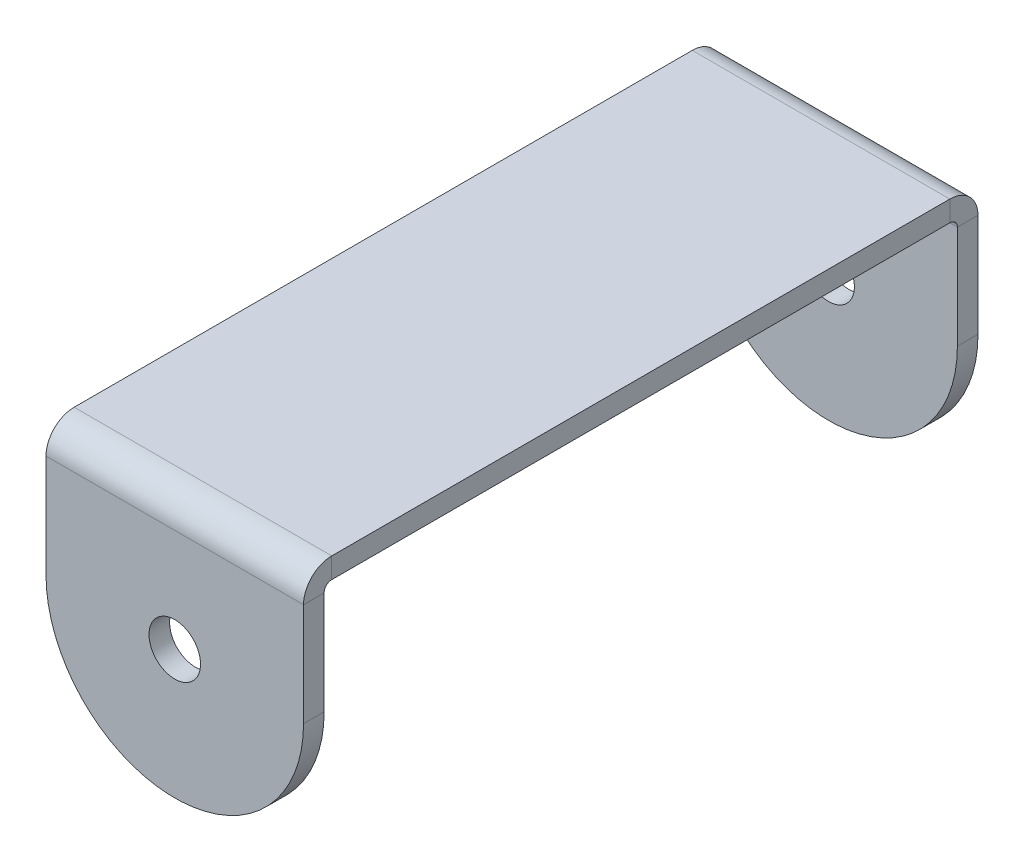
from build123d import *

# Parameters (mm, degrees)
SKETCH1_W               = 25
SKETCH1_H               = 60
BASE_FLANGE1_DEPTH      = 2
EDGE_FLANGE1_DEPTH      = 25
EDGE_FLANGE1_BEND_DEPTH = 25
CUT_EXTRUDE1_REACH      = 78.235
SKETCH12_R              = 2.5


# Sheet-metal steps are written as plain solids
with BuildPart() as part:
    # Sketch1 → Base-Flange1 (new body)
    with BuildSketch(Plane(origin=(0, 0, 0), x_dir=(1, 0, 0), z_dir=(0, 1, 0))):
        with Locations((12.5, 30)):
            Rectangle(SKETCH1_W, SKETCH1_H)
    extrude(amount=-BASE_FLANGE1_DEPTH)

    # Edge-Flange1 section (across the edge) → Edge-Flange1 (add)
    with BuildSketch(Plane(origin=(25, -2, 0.7366), x_dir=(0, 0, -1), z_dir=(-1, 0, 0))):
        with BuildLine():
            Line((-2, 0.7366), (-2, 28))
            Line((-2, 28), (0, 28))
            Line((0, 28), (0, 0.7366))
            ThreePointArc((0, 0.7366), (0.215745145, 0.215745145), (0.7366, 0))
            Line((0.7366, 0), (0.7366, -2))
            ThreePointArc((0.7366, -2), (-1.198468417, -1.198468417), (-2, 0.7366))
        make_face()
    extrude(amount=EDGE_FLANGE1_DEPTH)

    # Edge-Flange1 section 2 (across the edge) → Edge-Flange1 bend (add)
    with BuildSketch(Plane(origin=(0, -2, -60.7366), x_dir=(0, 0, 1), z_dir=(1, 0, 0))):
        with BuildLine():
            Line((-2, 0.7366), (-2, 28))
            Line((-2, 28), (0, 28))
            Line((0, 28), (0, 0.7366))
            ThreePointArc((0, 0.7366), (0.215745145, 0.215745145), (0.7366, 0))
            Line((0.7366, 0), (0.7366, -2))
            ThreePointArc((0.7366, -2), (-1.198468417, -1.198468417), (-2, 0.7366))
        make_face()
    extrude(amount=EDGE_FLANGE1_BEND_DEPTH)

    # Cut-Extrude1: up to this face of the body (flat: up to its plane)
    cut_extrude1_end = Plane(part.part.faces().sort_by_distance((12.5, -16.3683, 2.7366))[0])
    # Sketch12 → Cut-Extrude1 (cut, up to the picked face)
    with BuildSketch(Plane(origin=(0, 0, -62.7366), x_dir=(-1, 0, 0), z_dir=(0, 0, -1)), mode=Mode.PRIVATE) as cut_extrude1_sk1:
        with Locations(Location((-12.5, -12.7366, 0), (0, 0, 90))):
            Circle(SKETCH12_R)
    cut_extrude1_tool1 = split(extrude(cut_extrude1_sk1.sketch, amount=-CUT_EXTRUDE1_REACH, mode=Mode.PRIVATE), bisect_by=cut_extrude1_end, keep=Keep.BOTH, mode=Mode.PRIVATE)
    # Sketch12 → Cut-Extrude1 (cut, up to the picked face)
    with BuildSketch(Plane(origin=(0, 0, -62.7366), x_dir=(-1, 0, 0), z_dir=(0, 0, -1)), mode=Mode.PRIVATE) as cut_extrude1_sk2:
        with BuildLine():
            Line((-25, -12.7366), (-25, -30))
            Line((-25, -30), (0, -30))
            Line((0, -30), (0, -12.7366))
            ThreePointArc((0, -12.7366), (-12.5, -25.2366), (-25, -12.7366))
        make_face()
    cut_extrude1_tool2 = split(extrude(cut_extrude1_sk2.sketch, amount=-CUT_EXTRUDE1_REACH, mode=Mode.PRIVATE), bisect_by=cut_extrude1_end, keep=Keep.BOTH, mode=Mode.PRIVATE)
    add(cut_extrude1_tool1.solids().sort_by(Axis((12.5, -12.7366, -62.7366), (0, 0, 1)))[0], mode=Mode.SUBTRACT)
    add(cut_extrude1_tool2.solids().sort_by(Axis((12.5, -25.754349, -62.7366), (0, 0, 1)))[0], mode=Mode.SUBTRACT)


solid = part.part
